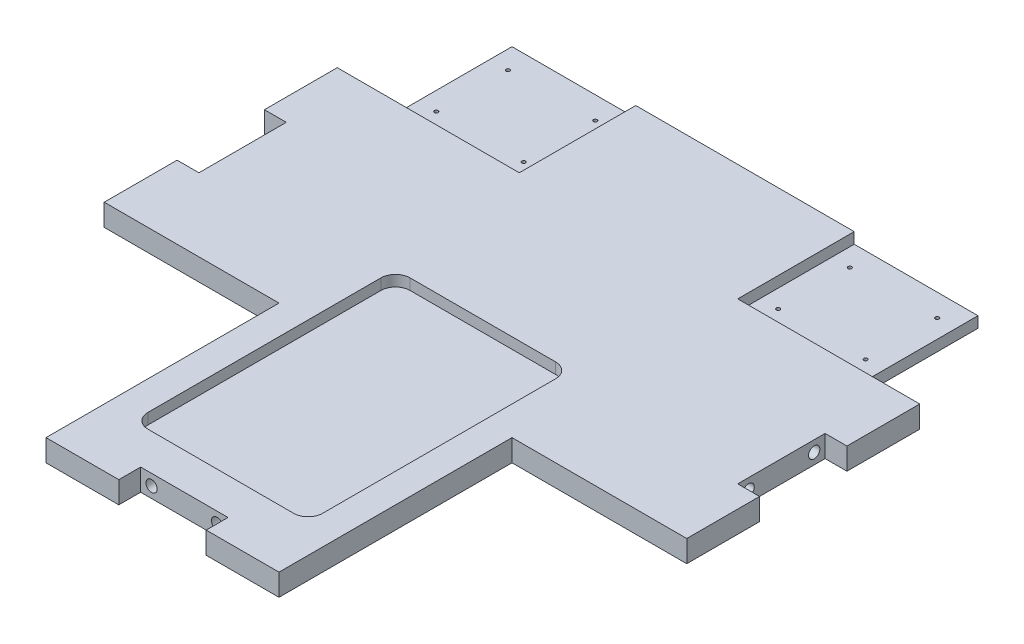
from build123d import *

# Parameters (mm, degrees)
SKETCH1_W                        = 254
SKETCH1_H                        = 254
BOSS_EXTRUDE1_DEPTH              = 9.525
SKETCH2_W                        = 25.4
SKETCH2_H                        = 50.8
CUT_EXTRUDE1_DEPTH               = 180.857514786
SKETCH4_W                        = 53.975
SKETCH4_H                        = 50.8
CUT_EXTRUDE2_DEPTH               = 4.7625
SKETCH6_W                        = 76.2
SKETCH6_H                        = 101.6
CUT_EXTRUDE3_DEPTH               = 180.857514786
SKETCH7_W                        = 9.525
SKETCH7_H                        = 38.1
SKETCH7_W_2                      = 38.1
SKETCH7_H_2                      = 9.525
CUT_EXTRUDE4_DEPTH               = 180.857514786
F_10_0_1935_DIAMETER_HOLE1_D     = 4.9149
F_10_0_1935_DIAMETER_HOLE1_DEPTH = 12.7
F_10_0_1935_DIAMETER_HOLE1_TIP   = 1.476584928
F_10_0_1935_DIAMETER_HOLE2_D     = 4.9149
F_10_0_1935_DIAMETER_HOLE2_DEPTH = 12.7
F_10_0_1935_DIAMETER_HOLE2_TIP   = 1.476584928
F_10_0_1935_DIAMETER_HOLE3_D     = 4.9149
F_10_0_1935_DIAMETER_HOLE3_DEPTH = 12.7
F_10_0_1935_DIAMETER_HOLE3_TIP   = 1.476584928
SKETCH17_W                       = 76.2
SKETCH17_H                       = 114.3
CUT_EXTRUDE6_DEPTH               = 4.7625
FILLET1_R                        = 6.35
SKETCH16_R                       = 0.79375
CUT_EXTRUDE7_DEPTH               = 180.668253752


with BuildPart() as part:
    # Sketch1 → Boss-Extrude1 (new body)
    with BuildSketch(Plane(origin=(0, 0, 0), x_dir=(1, 0, 0), z_dir=(0, 1, 0))):
        Rectangle(SKETCH1_W, SKETCH1_H)
    extrude(amount=BOSS_EXTRUDE1_DEPTH)

    # Sketch2 → Cut-Extrude1 (cut, through all)
    with BuildSketch(Plane(origin=(0, 9.525, 0), x_dir=(1, 0, 0), z_dir=(0, 1, 0))):
        with Locations((-114.3, 101.6)):
            Rectangle(SKETCH2_W, SKETCH2_H)
        with Locations((114.3, 101.6)):
            Rectangle(SKETCH2_W, SKETCH2_H)
    extrude(amount=-CUT_EXTRUDE1_DEPTH, mode=Mode.SUBTRACT)

    # Sketch4 → Cut-Extrude2 (cut)
    with BuildSketch(Plane(origin=(0, 9.525, 0), x_dir=(1, 0, 0), z_dir=(0, 1, 0))):
        with Locations((-74.6125, 101.6)):
            Rectangle(SKETCH4_W, SKETCH4_H)
        with Locations((74.6125, 101.6)):
            Rectangle(SKETCH4_W, SKETCH4_H)
    extrude(amount=-CUT_EXTRUDE2_DEPTH, mode=Mode.SUBTRACT)

    # Sketch6 → Cut-Extrude3 (cut, through all)
    with BuildSketch(Plane(origin=(0, 9.525, 0), x_dir=(1, 0, 0), z_dir=(0, 1, 0))):
        with Locations((-88.9, -76.2)):
            Rectangle(SKETCH6_W, SKETCH6_H)
        with Locations((88.9, -76.2)):
            Rectangle(SKETCH6_W, SKETCH6_H)
    extrude(amount=-CUT_EXTRUDE3_DEPTH, mode=Mode.SUBTRACT)

    # Sketch7 → Cut-Extrude4 (cut, through all)
    with BuildSketch(Plane(origin=(0, 9.525, 0), x_dir=(1, 0, 0), z_dir=(0, 1, 0))):
        with Locations((-122.2375, 25.4)):
            Rectangle(SKETCH7_W, SKETCH7_H)
        with Locations((122.2375, 25.4)):
            Rectangle(SKETCH7_W, SKETCH7_H)
        with Locations((0, -122.2375)):
            Rectangle(SKETCH7_W_2, SKETCH7_H_2)
    extrude(amount=-CUT_EXTRUDE4_DEPTH, mode=Mode.SUBTRACT)

    # #10 (0.1935) Diameter Hole1
    with Locations(Plane(origin=(117.475, 0, 0), x_dir=(0, 0, -1), z_dir=(1, 0, 0))):
        with Locations((11.1125, 4.7625), (39.6875, 4.7625)):
            Hole(F_10_0_1935_DIAMETER_HOLE1_D / 2, depth=F_10_0_1935_DIAMETER_HOLE1_DEPTH)
            with Locations((0, 0, -(F_10_0_1935_DIAMETER_HOLE1_DEPTH + F_10_0_1935_DIAMETER_HOLE1_TIP / 2))):  # 118° drill point
                Cone(0, F_10_0_1935_DIAMETER_HOLE1_D / 2, F_10_0_1935_DIAMETER_HOLE1_TIP, mode=Mode.SUBTRACT)

    # #10 (0.1935) Diameter Hole2
    with Locations(Plane.XY.offset(117.475)):
        with Locations((-14.2875, 4.7625), (14.2875, 4.7625)):
            Hole(F_10_0_1935_DIAMETER_HOLE2_D / 2, depth=F_10_0_1935_DIAMETER_HOLE2_DEPTH)
            with Locations((0, 0, -(F_10_0_1935_DIAMETER_HOLE2_DEPTH + F_10_0_1935_DIAMETER_HOLE2_TIP / 2))):  # 118° drill point
                Cone(0, F_10_0_1935_DIAMETER_HOLE2_D / 2, F_10_0_1935_DIAMETER_HOLE2_TIP, mode=Mode.SUBTRACT)

    # #10 (0.1935) Diameter Hole3
    with Locations(Plane.ZY.offset(117.475)):
        with Locations((-39.6875, 4.7625), (-11.1125, 4.7625)):
            Hole(F_10_0_1935_DIAMETER_HOLE3_D / 2, depth=F_10_0_1935_DIAMETER_HOLE3_DEPTH)
            with Locations((0, 0, -(F_10_0_1935_DIAMETER_HOLE3_DEPTH + F_10_0_1935_DIAMETER_HOLE3_TIP / 2))):  # 118° drill point
                Cone(0, F_10_0_1935_DIAMETER_HOLE3_D / 2, F_10_0_1935_DIAMETER_HOLE3_TIP, mode=Mode.SUBTRACT)

    # Sketch17 → Cut-Extrude6 (cut)
    with BuildSketch(Plane(origin=(0, 9.525, 0), x_dir=(1, 0, 0), z_dir=(0, 1, 0))):
        with Locations((0, -44.45)):
            Rectangle(SKETCH17_W, SKETCH17_H)
    extrude(amount=-CUT_EXTRUDE6_DEPTH, mode=Mode.SUBTRACT)

    # Fillet1
    fillet1_edges = [part.edges().sort_by_distance(p)[0] for p in [
        (-38.1, 7.14375, 101.6),
        (38.1, 7.14375, 101.6),
        (38.1, 7.14375, -12.7),
        (-38.1, 7.14375, -12.7),
    ]]
    fillet(fillet1_edges, radius=FILLET1_R)

    # Sketch16 → Cut-Extrude7 (cut, through all)
    with BuildSketch(Plane(origin=(0, 4.7625, 0), x_dir=(1, 0, 0), z_dir=(0, 1, 0))):
        with Locations((93.599, 117.221)):
            Circle(SKETCH16_R)
        with Locations((55.499, 117.221)):
            Circle(SKETCH16_R)
        with Locations((55.499, 85.979)):
            Circle(SKETCH16_R)
        with Locations((93.599, 85.979)):
            Circle(SKETCH16_R)
        with Locations((-93.599, 85.979)):
            Circle(SKETCH16_R)
        with Locations((-55.499, 85.979)):
            Circle(SKETCH16_R)
        with Locations((-55.499, 117.221)):
            Circle(SKETCH16_R)
        with Locations((-93.599, 117.221)):
            Circle(SKETCH16_R)
    extrude(amount=-CUT_EXTRUDE7_DEPTH, mode=Mode.SUBTRACT)


solid = part.part
